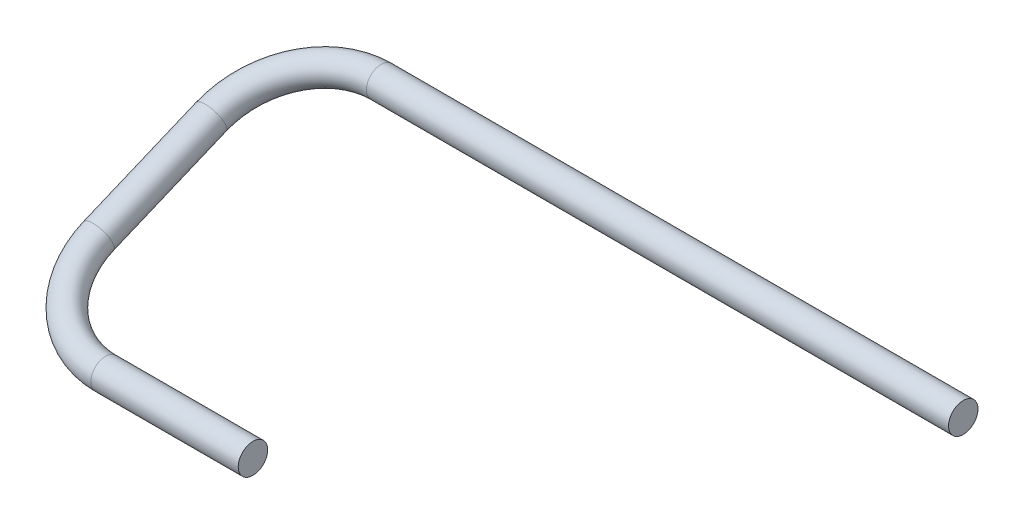
from build123d import *

# Parameters (mm, degrees)
SWEEP1_PROFILE_R = 6.35


with BuildPart() as part:
    # Sweep1: sweep along a curve in space
    with BuildLine() as sweep1_path:
        Line((-296.632700308, 1724.025, -224.028), (-547.410454363, 1724.025, -224.028))
        ThreePointArc((-547.410454363, 1724.025, -224.028), (-574.351222726, 1719.728596774, -213.729001503), (-585.510454363, 1709.356161838, -188.865019652))
        Line((-585.510454363, 1709.356161838, -188.865019652), (-585.510454363, 1689.163838162, -140.461576059))
        ThreePointArc((-547.410454363, 1674.495, -105.298595711), (-574.351222726, 1678.791403226, -115.597594208), (-585.510454363, 1689.163838162, -140.461576059))
        Line((-483.910454363, 1674.495, -105.298595711), (-547.410454363, 1674.495, -105.298595711))
    # Sweep1 profile (on start of the path) → Sweep1 (sweep)
    with BuildSketch(Plane(origin=(-296.632700308, 1724.025, -224.028), x_dir=(0, 0, -1), z_dir=(-1, 0, 0))):
        Circle(SWEEP1_PROFILE_R)
    sweep(path=sweep1_path.line)


solid = part.part
